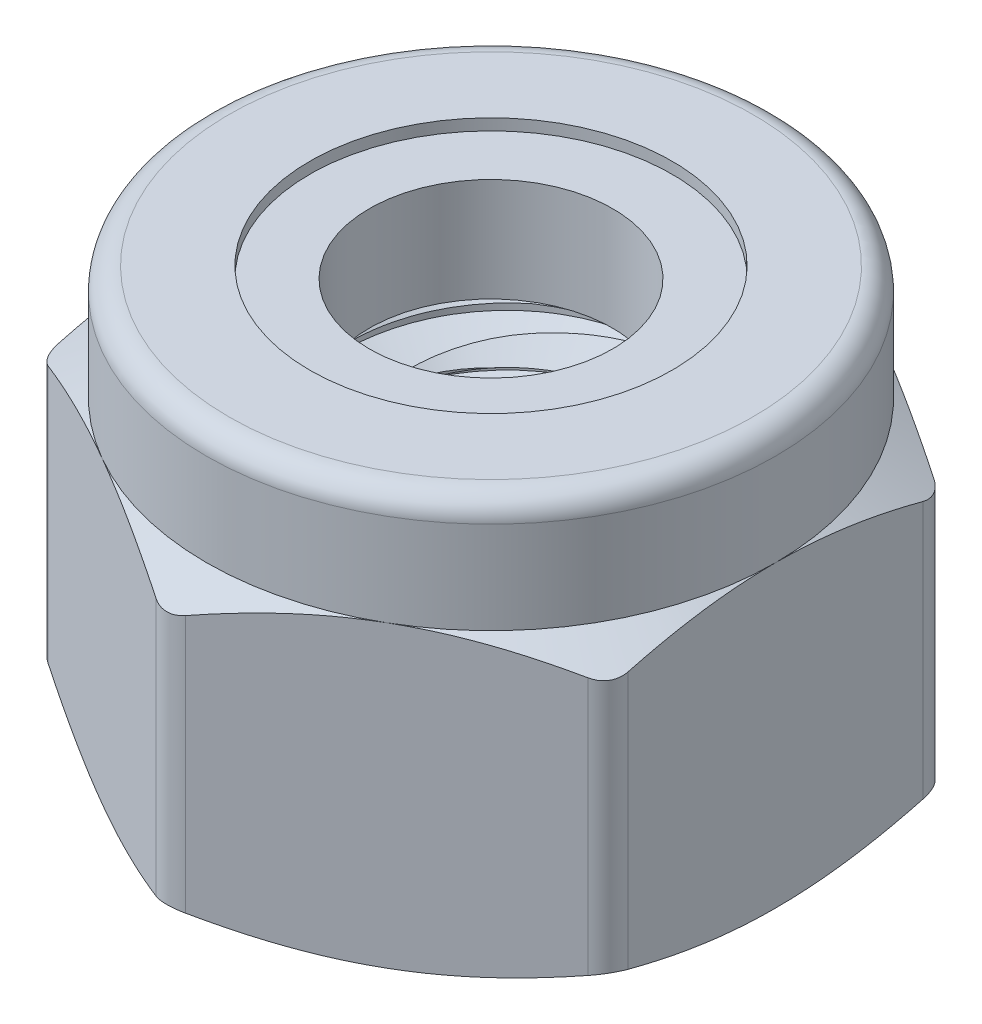
from build123d import *
from build123d.topology import SkipClean

# Parameters (mm, degrees)
BOSS_EXTRUDE1_START = 0.890427
BOSS_EXTRUDE1_DEPTH = 2.890427
FILLET1_R           = 0.283148148
SWEEP1_PITCH        = 0.5


with BuildPart() as part:
    # Sketch2 → Boss-Extrude1 (new body)
    with BuildSketch(Plane(origin=(0, 0, 0), x_dir=(1, 0, 0), z_dir=(0, 1, 0)).offset(BOSS_EXTRUDE1_START)):
        Polygon((2.75, 1.58771324), (0, 3.175426481), (-2.75, 1.58771324), (-2.75, -1.58771324), (0, -3.175426481), (2.75, -1.58771324), align=None)
    extrude(amount=-BOSS_EXTRUDE1_DEPTH)

    # Sketch3 → Cut-Revolve1 (revolve, cut)
    with BuildSketch(Plane.XY):
        Polygon((1.5, 1.612114815), (3.184722222, 0.639439987), (3.184722222, 1.612114815), align=None)
        Polygon((1.5, -2.721687836), (3.184722222, -1.749013008), (3.184722222, -2.721687836), align=None)
    revolve(axis=Axis((0, 2, 0), (0, -1, 0)), mode=Mode.SUBTRACT)

    # Fillet1
    fillet1_edges = [part.edges().sort_by_distance(p)[0] for p in [
        (-2.75, -0.554786511, -1.58771324),
        (-2.75, -0.554786511, 1.58771324),
        (0, -0.554786511, 3.175426481),
        (0, -0.554786511, -3.175426481),
        (2.75, -0.554786511, -1.58771324),
        (2.75, -0.554786511, 1.58771324),
    ]]
    fillet(fillet1_edges, radius=FILLET1_R)

    # Sketch5 → Cut-Revolve2 (revolve, cut)
    with BuildSketch(Plane.XY, mode=Mode.PRIVATE) as cut_revolve2_sk:
        Polygon((-1.75, -2), (-1.5, -1.75), (-1.5, 0.640426979), (-1.75, 0.890426979), (0, 0.890426979), (0, -2), align=None)
    revolve(cut_revolve2_sk.sketch.rotate(Axis((0, 2, 0), (0, -1, 0)), 270), axis=Axis((0, 2, 0), (0, -1, 0)), mode=Mode.SUBTRACT)

    # Sketch4 → Revolve1 (revolve)
    with BuildSketch(Plane.XY, mode=Mode.PRIVATE) as revolve1_sk:
        with BuildLine():
            Line((-1.75, 2), (-2.53125, 2))
            ThreePointArc((-2.53125, 2), (-2.685929608, 1.935929608), (-2.75, 1.78125))
            Line((-2.75, 1.78125), (-2.75, 0.890426979))
            Line((-2.75, 0.890426979), (-2.640625, 0.890426979))
            Line((-2.640625, 0.890426979), (-2.640625, 1.78125))
            ThreePointArc((-2.640625, 1.78125), (-2.608589804, 1.858589804), (-2.53125, 1.890625))
            Line((-2.53125, 1.890625), (-1.75, 1.890625))
            Line((-1.75, 1.890625), (-1.75, 2))
        make_face()
    revolve(revolve1_sk.sketch.rotate(Axis((0, 2, 0), (0, -1, 0)), 270), axis=Axis((0, 2, 0), (0, -1, 0)))

    # Sweep1: the profile of Sketch8 profile screwed along a left-hand helix of 8 turns, 6 arcs to a turn; built about Z, then put on its axis
    sweep1_z = Axis((0, 0, 0), (0, 0, 1))
    sweep1_corners = [(1.527063294, 0, 0.015625), (1.527063294, 0, -0.453125), (1.174940474, 0, -0.249826795), (1.174940474, 0, -0.187673205)]
    with BuildLine(mode=Mode.PRIVATE) as sweep1_profile:
        Line(sweep1_corners[0], sweep1_corners[1])
        Line(sweep1_corners[1], sweep1_corners[2])
        Line(sweep1_corners[2], sweep1_corners[3])
        Line(sweep1_corners[3], sweep1_corners[0])
    sweep1_cap = Face(sweep1_profile.wire())
    sweep1_turn_angles = [0, -30, -60, -90, -120, -150, -180, -210, -240, -270, -300, -330, -360]
    sweep1_turn_weights = [1, 0.8660254037844387, 1, 0.8660254037844387, 1, 0.8660254037844387, 1, 0.8660254037844387, 1, 0.8660254037844387, 1, 0.8660254037844387, 1]
    sweep1_turn_rails = [Edge.make_bspline([Vector(p[0], p[1], 0).rotate(sweep1_z, sweep1_turn_angles[k]) / sweep1_turn_weights[k] + Vector(0, 0, p[2] + -SWEEP1_PITCH * sweep1_turn_angles[k] / 360) for k in range(13)], [0, 0, 0, 1, 1, 2, 2, 3, 3, 4, 4, 5, 5, 6, 6, 6], 2, sweep1_turn_weights) for p in sweep1_corners]
    sweep1_turn_sides = [Face.make_surface_from_curves(sweep1_turn_rails[p[0]], sweep1_turn_rails[p[1]]) for p in [(0, 1), (1, 2), (2, 3), (3, 0)]]
    sweep1 = Plane(origin=(0, -2, 0), x_dir=(-1, 0, 0), z_dir=(0, 1, 0)) * Solid(Shell([*[p.moved(Location((0, 0, SWEEP1_PITCH * i))) for i in range(8) for p in sweep1_turn_sides], sweep1_cap, sweep1_cap.rotate(sweep1_z, -2880).moved(Location((0, 0, -SWEEP1_PITCH * -2880 / 360)))]))
    add(sweep1)

    # Sketch9 → Cut-Revolve3 (revolve, cut)
    with SkipClean():  # the faces are left unmerged after this step: merging them gives an invalid solid
        with BuildSketch(Plane.XY, mode=Mode.PRIVATE) as cut_revolve3_sk:
            Polygon((-1.75, 2.109375), (-1.75, 0.890426979), (-1.121113886, 0.261540865), (-1.121113886, 2.109375), align=None)
            Polygon((-1.121113886, -1.371113886), (-1.75, -2), (-1.75, -2.46875), (-1.121113886, -2.46875), align=None)
        revolve(cut_revolve3_sk.sketch.rotate(Axis((0, 2, 0), (0, -1, 0)), 135.522483167), axis=Axis((0, 2, 0), (0, -1, 0)), mode=Mode.SUBTRACT)


with BuildPart() as body_2:
    # Sketch6 → Revolve2 (revolve)
    with BuildSketch(Plane.XY, mode=Mode.PRIVATE) as revolve2_sk:
        with BuildLine():
            Line((-2.53125, 1.890625), (-1.175240474, 1.890625))
            Line((-1.175240474, 1.890625), (-1.175240474, 0.890426979))
            Line((-1.175240474, 0.890426979), (-2.640625, 0.890426979))
            Line((-2.640625, 0.890426979), (-2.640625, 1.78125))
            ThreePointArc((-2.640625, 1.78125), (-2.608589804, 1.858589804), (-2.53125, 1.890625))
        make_face()
    revolve(revolve2_sk.sketch.rotate(Axis((0, 2, 0), (0, -1, 0)), 270), axis=Axis((0, 2, 0), (0, -1, 0)))


solid = Compound([part.part, body_2.part])
